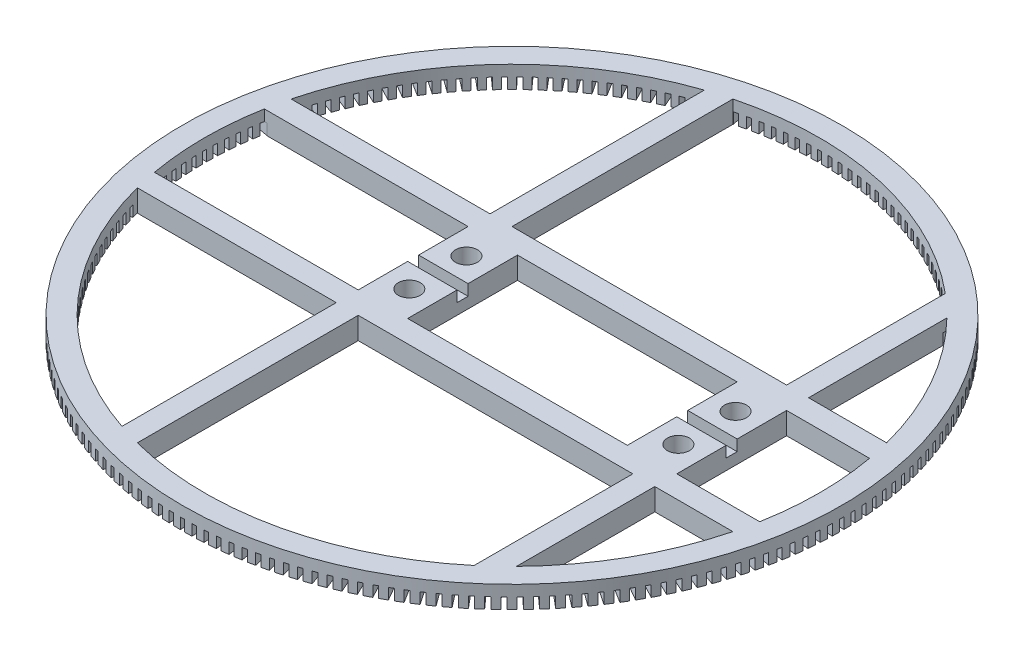
from build123d import *

# Parameters (mm, degrees)
SKETCH1_R           = 60
SKETCH1_R_2         = 2
SKETCH1_W           = 40
SKETCH1_H           = 20
BOSS_EXTRUDE1_DEPTH = 4
SKETCH3_W           = 58
SKETCH3_H           = 2
CUT_EXTRUDE1_DEPTH  = 2
SKETCH4_W           = 5
SKETCH4_H           = 0.8
SKETCH4_W_2         = 0.8
SKETCH4_H_2         = 5
CUT_EXTRUDE10_DEPTH = 2
SKETCH6_W           = 5
SKETCH6_H           = 0.8
SKETCH6_W_2         = 0.8
SKETCH6_H_2         = 5
CUT_EXTRUDE11_DEPTH = 2


with BuildPart() as part:
    # Sketch1 → Boss-Extrude1 (new body)
    with BuildSketch(Plane(origin=(0, 0, 0), x_dir=(1, 0, 0), z_dir=(0, 1, 0))):
        with Locations((-11, 0)):
            Circle(SKETCH1_R)
        with BuildLine():
            Line((-29, 10), (-29, -10))
            Line((-29, -10), (-66.099909256, -10))
            ThreePointArc((-66.099909256, -10), (-67, 0), (-66.099909256, 10))
            Line((-66.099909256, 10), (-29, 10))
        make_face(mode=Mode.SUBTRACT)
        with BuildLine():
            Line((25, 14), (-25, 14))
            Line((-25, 14), (-25, 54.221766847))
            ThreePointArc((-25, 54.221766847), (1.372253602, 54.616182042), (25, 42.895221179))
            Line((25, 42.895221179), (25, 14))
        make_face(mode=Mode.SUBTRACT)
        with BuildLine():
            Line((29, -10), (29, 10))
            Line((29, 10), (44.099909256, 10))
            ThreePointArc((44.099909256, 10), (45, 0), (44.099909256, -10))
            Line((44.099909256, -10), (29, -10))
        make_face(mode=Mode.SUBTRACT)
        with BuildLine():
            Line((-25, -14), (25, -14))
            Line((25, -14), (25, -42.895221179))
            ThreePointArc((25, -42.895221179), (1.372253602, -54.616182042), (-25, -54.221766847))
            Line((-25, -54.221766847), (-25, -14))
        make_face(mode=Mode.SUBTRACT)
        with Locations((-24.5, -5.2)):
            Circle(SKETCH1_R_2, mode=Mode.SUBTRACT)
        with Locations((24.5, -5.2)):
            Circle(SKETCH1_R_2, mode=Mode.SUBTRACT)
        with Locations((-24.5, 5.2)):
            Circle(SKETCH1_R_2, mode=Mode.SUBTRACT)
        Rectangle(SKETCH1_W, SKETCH1_H, mode=Mode.SUBTRACT)
        with Locations((24.5, 5.2)):
            Circle(SKETCH1_R_2, mode=Mode.SUBTRACT)
        with BuildLine():
            Line((-65.221766847, -14), (-29, -14))
            Line((-29, -14), (-29, -53.028294334))
            ThreePointArc((-29, -53.028294334), (-52.046289007, -38.094647376), (-65.221766847, -14))
        make_face(mode=Mode.SUBTRACT)
        with BuildLine():
            Line((-29, 14), (-65.221766847, 14))
            ThreePointArc((-65.221766847, 14), (-52.046289007, 38.094647376), (-29, 53.028294334))
            Line((-29, 53.028294334), (-29, 14))
        make_face(mode=Mode.SUBTRACT)
        with BuildLine():
            Line((29, 14), (29, 39.191835885))
            ThreePointArc((29, 39.191835885), (37.765689637, 27.530120128), (43.221766847, 14))
            Line((43.221766847, 14), (29, 14))
        make_face(mode=Mode.SUBTRACT)
        with BuildLine():
            Line((29, -14), (43.221766847, -14))
            ThreePointArc((43.221766847, -14), (37.765689637, -27.530120128), (29, -39.191835885))
            Line((29, -39.191835885), (29, -14))
        make_face(mode=Mode.SUBTRACT)
    extrude(amount=BOSS_EXTRUDE1_DEPTH)

    # Sketch3 → Cut-Extrude1 (cut)
    with BuildSketch(Plane(origin=(0, 4, 0), x_dir=(1, 0, 0), z_dir=(0, 1, 0))):
        Rectangle(SKETCH3_W, SKETCH3_H)
    extrude(amount=-CUT_EXTRUDE1_DEPTH, mode=Mode.SUBTRACT)

    # Sketch4 → Cut-Extrude10 (cut)
    with BuildSketch(Plane.XZ):
        Polygon((-71.449185236, 2.511175881), (-71.477104833, 1.71166322), (-66.480150698, 1.537165736), (-66.452231101, 2.336678398), align=None)
        with Locations((-69, 0)):
            Rectangle(SKETCH4_W, SKETCH4_H)
        Polygon((-71.324722451, 4.619292282), (-71.38052763, 3.821241041), (-66.392707379, 3.472458673), (-66.3369022, 4.270509913), align=None)
        Polygon((-71.126763284, 6.721780786), (-71.210386055, 5.92616327), (-66.237776578, 5.403520953), (-66.154153808, 6.19913847), align=None)
        Polygon((-70.855548918, 8.816079836), (-70.966887399, 8.023865381), (-66.015547056, 7.327999876), (-65.904208575, 8.120214331), align=None)
        Polygon((-70.511409786, 10.89963785), (-70.650328328, 10.111791648), (-65.726289563, 9.243550759), (-65.587371021, 10.031396962), align=None)
        Polygon((-70.094765168, 12.969916335), (-70.261094521, 12.187398254), (-65.370356517, 11.1478398), (-65.204027164, 11.930357881), align=None)
        Polygon((-69.606122681, 15.024392974), (-69.799660198, 14.248156393), (-64.948181567, 13.038546915), (-64.75464405, 13.814783496), align=None)
        Polygon((-69.046077662, 17.060564705), (-69.266587547, 16.291555349), (-64.460279067, 14.913368569), (-64.239769182, 15.682377926), align=None)
        Polygon((-68.415312438, 19.075950766), (-68.662526034, 18.315105553), (-63.907243452, 16.770020581), (-63.660029857, 17.530865794), align=None)
        Polygon((-67.7145955, 21.06809572), (-67.988211615, 20.316341623), (-63.289748511, 18.606240906), (-63.016132396, 19.357995003), align=None)
        Polygon((-66.944780564, 23.034572443), (-67.244465839, 22.29282536), (-62.608546566, 20.419792393), (-62.308861291, 21.161539476), align=None)
        Polygon((-66.10680553, 24.972985089), (-66.432194845, 24.242148723), (-61.864467556, 22.208465508), (-61.539078242, 22.939301874), align=None)
        Polygon((-65.201691342, 26.880971999), (-65.55238826, 26.161936762), (-61.058418028, 23.970081028), (-60.707721111, 24.689116265), align=None)
        Polygon((-64.230540743, 28.756208586), (-64.606117993, 28.049850511), (-60.191380029, 25.702492697), (-59.815802779, 26.408850772), align=None)
        Polygon((-63.194536929, 30.596410162), (-63.594536929, 29.903589838), (-59.26440991, 27.403589838), (-58.86440991, 28.096410162), align=None)
        Polygon((-62.094942112, 32.399334725), (-62.518877523, 31.720896248), (-58.278637042, 29.071299926), (-57.854701631, 29.749738403), align=None)
        Polygon((-60.933095978, 34.162785689), (-61.380450301, 33.499555631), (-57.235262438, 30.703591114), (-56.787908115, 31.366821172), align=None)
        Polygon((-59.710414059, 35.884614561), (-60.180642261, 35.237400966), (-56.135557289, 32.298474704), (-55.665329087, 32.9456883), align=None)
        Polygon((-58.428386003, 37.562723559), (-58.920915183, 36.932314956), (-54.980861415, 33.854007579), (-54.488332235, 34.484416182), align=None)
        Polygon((-57.088573765, 39.195068163), (-57.602803853, 38.582232609), (-53.772581637, 35.36829456), (-53.258351549, 35.981130115), align=None)
        Polygon((-55.692609699, 40.779659615), (-56.227914184, 40.185143755), (-52.512190057, 36.839490723), (-51.976885571, 37.434006583), align=None)
        Polygon((-54.242194572, 42.314567333), (-54.797921269, 41.739095493), (-51.201222267, 38.26580364), (-50.645495571, 38.841275481), align=None)
        Polygon((-52.739095493, 43.797921269), (-53.314567333, 43.242194572), (-49.841275481, 39.645495571), (-49.26580364, 40.201222267), align=None)
        Polygon((-51.185143755, 45.227914184), (-51.779659615, 44.692609699), (-48.434006583, 40.976885571), (-47.839490723, 41.512190057), align=None)
        Polygon((-49.582232609, 46.602803853), (-50.195068163, 46.088573765), (-46.981130115, 42.258351549), (-46.36829456, 42.772581637), align=None)
        Polygon((-47.932314956, 47.920915183), (-48.562723559, 47.428386003), (-45.484416182, 43.488332235), (-44.854007579, 43.980861415), align=None)
        Polygon((-46.237400966, 49.180642261), (-46.884614561, 48.710414059), (-43.9456883, 44.665329087), (-43.298474704, 45.135557289), align=None)
        Polygon((-44.499555631, 50.380450301), (-45.162785689, 49.933095978), (-42.366821172, 45.787908115), (-41.703591114, 46.235262438), align=None)
        Polygon((-42.720896248, 51.518877523), (-43.399334725, 51.094942112), (-40.749738403, 46.854701631), (-40.071299926, 47.278637042), align=None)
        Polygon((-40.903589838, 52.594536929), (-41.596410162, 52.194536929), (-39.096410162, 47.86440991), (-38.403589838, 48.26440991), align=None)
        Polygon((-39.049850511, 53.606117993), (-39.756208586, 53.230540743), (-37.408850772, 48.815802779), (-36.702492697, 49.191380029), align=None)
        Polygon((-37.161936762, 54.55238826), (-37.880971999, 54.201691342), (-35.689116265, 49.707721111), (-34.970081028, 50.058418028), align=None)
        Polygon((-35.242148723, 55.432194845), (-35.972985089, 55.10680553), (-33.939301874, 50.539078242), (-33.208465508, 50.864467556), align=None)
        Polygon((-33.29282536, 56.244465839), (-34.034572443, 55.944780564), (-32.161539476, 51.308861291), (-31.419792393, 51.608546566), align=None)
        Polygon((-31.316341623, 56.988211615), (-32.06809572, 56.7145955), (-30.357995003, 52.016132396), (-29.606240906, 52.289748511), align=None)
        Polygon((-29.315105553, 57.662526034), (-30.075950766, 57.415312438), (-28.530865794, 52.660029857), (-27.770020581, 52.907243452), align=None)
        Polygon((-27.291555349, 58.266587547), (-28.060564705, 58.046077662), (-26.682377926, 53.239769182), (-25.913368569, 53.460279067), align=None)
        Polygon((-25.248156393, 58.799660198), (-26.024392974, 58.606122681), (-24.814783496, 53.75464405), (-24.038546915, 53.948181567), align=None)
        Polygon((-23.187398254, 59.261094521), (-23.969916335, 59.094765168), (-22.930357881, 54.204027164), (-22.1478398, 54.370356517), align=None)
        Polygon((-21.111791648, 59.650328328), (-21.89963785, 59.511409786), (-21.031396962, 54.587371021), (-20.243550759, 54.726289563), align=None)
        Polygon((-19.023865381, 59.966887399), (-19.816079836, 59.855548918), (-19.120214331, 54.904208575), (-18.327999876, 55.015547056), align=None)
        Polygon((-16.92616327, 60.210386055), (-17.721780786, 60.126763284), (-17.19913847, 55.154153808), (-16.403520953, 55.237776578), align=None)
        Polygon((-14.821241041, 60.38052763), (-15.619292282, 60.324722451), (-15.270509913, 55.3369022), (-14.472458673, 55.392707379), align=None)
        Polygon((-12.71166322, 60.477104833), (-13.511175881, 60.449185236), (-13.336678398, 55.452231101), (-12.537165736, 55.480150698), align=None)
        with Locations((-11, 58)):
            Rectangle(SKETCH4_W_2, SKETCH4_H_2)
        Polygon((-8.488824119, 60.449185236), (-9.28833678, 60.477104833), (-9.462834264, 55.480150698), (-8.663321602, 55.452231101), align=None)
        Polygon((-6.380707718, 60.324722451), (-7.178758959, 60.38052763), (-7.527541327, 55.392707379), (-6.729490087, 55.3369022), align=None)
        Polygon((-4.278219214, 60.126763284), (-5.07383673, 60.210386055), (-5.596479047, 55.237776578), (-4.800861531, 55.154153808), align=None)
        Polygon((-2.183920164, 59.855548918), (-2.976134619, 59.966887399), (-3.672000124, 55.015547056), (-2.879785669, 54.904208575), align=None)
        Polygon((-0.10036215, 59.511409786), (-0.888208352, 59.650328328), (-1.756449241, 54.726289563), (-0.968603038, 54.587371021), align=None)
        Polygon((1.969916335, 59.094765168), (1.187398254, 59.261094521), (0.1478398, 54.370356517), (0.930357881, 54.204027164), align=None)
        Polygon((4.024392974, 58.606122681), (3.248156393, 58.799660198), (2.038546915, 53.948181567), (2.814783496, 53.75464405), align=None)
        Polygon((6.060564705, 58.046077662), (5.291555349, 58.266587547), (3.913368569, 53.460279067), (4.682377926, 53.239769182), align=None)
        Polygon((8.075950766, 57.415312438), (7.315105553, 57.662526034), (5.770020581, 52.907243452), (6.530865794, 52.660029857), align=None)
        Polygon((10.06809572, 56.7145955), (9.316341623, 56.988211615), (7.606240906, 52.289748511), (8.357995003, 52.016132396), align=None)
        Polygon((12.034572443, 55.944780564), (11.29282536, 56.244465839), (9.419792393, 51.608546566), (10.161539476, 51.308861291), align=None)
        Polygon((13.972985089, 55.10680553), (13.242148723, 55.432194845), (11.208465508, 50.864467556), (11.939301874, 50.539078242), align=None)
        Polygon((15.880971999, 54.201691342), (15.161936762, 54.55238826), (12.970081028, 50.058418028), (13.689116265, 49.707721111), align=None)
        Polygon((17.756208586, 53.230540743), (17.049850511, 53.606117993), (14.702492697, 49.191380029), (15.408850772, 48.815802779), align=None)
        Polygon((19.596410162, 52.194536929), (18.903589838, 52.594536929), (16.403589838, 48.26440991), (17.096410162, 47.86440991), align=None)
        Polygon((21.399334725, 51.094942112), (20.720896248, 51.518877523), (18.071299926, 47.278637042), (18.749738403, 46.854701631), align=None)
        Polygon((23.162785689, 49.933095978), (22.499555631, 50.380450301), (19.703591114, 46.235262438), (20.366821172, 45.787908115), align=None)
        Polygon((24.884614561, 48.710414059), (24.237400966, 49.180642261), (21.298474704, 45.135557289), (21.9456883, 44.665329087), align=None)
        Polygon((26.562723559, 47.428386003), (25.932314956, 47.920915183), (22.854007579, 43.980861415), (23.484416182, 43.488332235), align=None)
        Polygon((34.227914184, 40.185143755), (33.692609699, 40.779659615), (29.976885571, 37.434006583), (30.512190057, 36.839490723), align=None)
        Polygon((35.602803853, 38.582232609), (35.088573765, 39.195068163), (31.258351549, 35.981130115), (31.772581637, 35.36829456), align=None)
        Polygon((36.920915183, 36.932314956), (36.428386003, 37.562723559), (32.488332235, 34.484416182), (32.980861415, 33.854007579), align=None)
        Polygon((38.180642261, 35.237400966), (37.710414059, 35.884614561), (33.665329087, 32.9456883), (34.135557289, 32.298474704), align=None)
        Polygon((39.380450301, 33.499555631), (38.933095978, 34.162785689), (34.787908115, 31.366821172), (35.235262438, 30.703591114), align=None)
        Polygon((40.518877523, 31.720896248), (40.094942112, 32.399334725), (35.854701631, 29.749738403), (36.278637042, 29.071299926), align=None)
        Polygon((41.594536929, 29.903589838), (41.194536929, 30.596410162), (36.86440991, 28.096410162), (37.26440991, 27.403589838), align=None)
        Polygon((42.606117993, 28.049850511), (42.230540743, 28.756208586), (37.815802779, 26.408850772), (38.191380029, 25.702492697), align=None)
        Polygon((43.55238826, 26.161936762), (43.201691342, 26.880971999), (38.707721111, 24.689116265), (39.058418028, 23.970081028), align=None)
        Polygon((44.432194845, 24.242148723), (44.10680553, 24.972985089), (39.539078242, 22.939301874), (39.864467556, 22.208465508), align=None)
        Polygon((-70.650328328, -10.111791648), (-70.511409786, -10.89963785), (-65.587371021, -10.031396962), (-65.726289563, -9.243550759), align=None)
        Polygon((-70.966887399, -8.023865381), (-70.855548918, -8.816079836), (-65.904208575, -8.120214331), (-66.015547056, -7.327999876), align=None)
        Polygon((-71.210386055, -5.92616327), (-71.126763284, -6.721780786), (-66.154153808, -6.19913847), (-66.237776578, -5.403520953), align=None)
        Polygon((-71.38052763, -3.821241041), (-71.324722451, -4.619292282), (-66.3369022, -4.270509913), (-66.392707379, -3.472458673), align=None)
        Polygon((-71.477104833, -1.71166322), (-71.449185236, -2.511175881), (-66.452231101, -2.336678398), (-66.480150698, -1.537165736), align=None)
    extrude(amount=-CUT_EXTRUDE10_DEPTH, mode=Mode.SUBTRACT)

    # Sketch6 → Cut-Extrude11 (cut)
    with BuildSketch(Plane.XZ.offset(-2)):
        Polygon((28.191222958, 46.057855382), (27.578387404, 46.57208547), (24.364449355, 42.741863254), (24.97728491, 42.227633167), align=None)
        Polygon((29.77581441, 44.661891316), (29.18129855, 45.197195801), (25.835645518, 41.481471674), (26.430161378, 40.946167189), align=None)
        Polygon((31.310722128, 43.21147619), (30.735250288, 43.767202886), (27.261958435, 40.170503884), (27.837430276, 39.614777188), align=None)
        Polygon((32.794076064, 41.70837711), (32.238349367, 42.28384895), (28.641650366, 38.810557098), (29.197377062, 38.235085258), align=None)
        Polygon((34.224068979, 40.154425372), (33.688764494, 40.748941232), (29.973040367, 37.4032882), (30.508344852, 36.80877234), align=None)
        Polygon((45.240620634, 22.262106977), (44.940935359, 23.003854061), (40.305016086, 21.130821094), (40.604701361, 20.38907401), align=None)
        Polygon((45.98436641, 20.28562324), (45.710750295, 21.037377337), (41.012287191, 19.32727662), (41.285903306, 18.575522524), align=None)
        Polygon((46.658680829, 18.284387171), (46.411467233, 19.045232384), (41.656184652, 17.500147412), (41.903398247, 16.739302199), align=None)
        Polygon((47.262742342, 16.260836966), (47.042232457, 17.029846323), (42.235923977, 15.651659544), (42.456433862, 14.882650187), align=None)
        Polygon((47.795814993, 14.217438011), (47.602277477, 14.993674592), (42.750798845, 13.784065114), (42.944336362, 13.007828533), align=None)
        Polygon((48.257249316, 12.156679872), (48.090919963, 12.939197952), (43.200181959, 11.899639498), (43.366511312, 11.117121417), align=None)
        Polygon((48.646483123, 10.081073265), (48.507564581, 10.868919467), (43.583525816, 10.000678579), (43.722444358, 9.212832377), align=None)
        Polygon((48.963042194, 7.993146998), (48.851703714, 8.785361453), (43.90036337, 8.089495948), (44.011701851, 7.297281493), align=None)
        Polygon((49.20654085, 5.895444887), (49.12291808, 6.691062403), (44.150308603, 6.168420087), (44.233931373, 5.372802571), align=None)
        Polygon((49.376682425, 3.790522659), (49.320877246, 4.588573899), (44.333056995, 4.23979153), (44.388862174, 3.44174029), align=None)
        Polygon((49.473259628, 1.680944837), (49.445340031, 2.480457499), (44.448385896, 2.305960015), (44.476305493, 1.506447354), align=None)
        with Locations((46.996154795, -0.030718383)):
            Rectangle(SKETCH6_W, SKETCH6_H)
        Polygon((49.445340031, -2.541894264), (49.473259628, -1.742381602), (44.476305493, -1.567884119), (44.448385896, -2.36739678), align=None)
        Polygon((49.320877246, -4.650010664), (49.376682425, -3.851959424), (44.388862174, -3.503177055), (44.333056995, -4.301228296), align=None)
        Polygon((49.12291808, -6.752499168), (49.20654085, -5.956881652), (44.233931373, -5.434239336), (44.150308603, -6.229856852), align=None)
        Polygon((48.851703714, -8.846798218), (48.963042194, -8.054583763), (44.011701851, -7.358718258), (43.90036337, -8.150932713), align=None)
        Polygon((48.507564581, -10.930356233), (48.646483123, -10.14251003), (43.722444358, -9.274269142), (43.583525816, -10.062115344), align=None)
        Polygon((48.090919963, -13.000634717), (48.257249316, -12.218116637), (43.366511312, -11.178558183), (43.200181959, -11.961076263), align=None)
        Polygon((47.602277477, -15.055111357), (47.795814993, -14.278874776), (42.944336362, -13.069265298), (42.750798845, -13.845501879), align=None)
        Polygon((47.042232457, -17.091283088), (47.262742342, -16.322273731), (42.456433862, -14.944086952), (42.235923977, -15.713096309), align=None)
        Polygon((46.411467233, -19.106669149), (46.658680829, -18.345823936), (41.903398247, -16.800738964), (41.656184652, -17.561584177), align=None)
        Polygon((45.710750295, -21.098814102), (45.98436641, -20.347060006), (41.285903306, -18.636959289), (41.012287191, -19.388713386), align=None)
        Polygon((44.940935359, -23.065290826), (45.240620634, -22.323543742), (40.604701361, -20.450510775), (40.305016086, -21.192257859), align=None)
        Polygon((44.102960325, -25.003703472), (44.42834964, -24.272867106), (39.860622351, -22.23918389), (39.535233037, -22.970020256), align=None)
        Polygon((43.197846137, -26.911690382), (43.548543055, -26.192655145), (39.054572823, -24.000799411), (38.703875906, -24.719834648), align=None)
        Polygon((42.226695538, -28.786926968), (42.602272788, -28.080568894), (38.187534824, -25.73321108), (37.811957574, -26.439569154), align=None)
        Polygon((41.190691724, -30.627128544), (41.590691724, -29.934308221), (37.260564705, -27.434308221), (36.860564705, -28.127128544), align=None)
        Polygon((40.091096907, -32.430053107), (40.515032318, -31.75161463), (36.274791837, -29.102018309), (35.850856426, -29.780456786), align=None)
        Polygon((38.929250773, -34.193504072), (39.376605096, -33.530274014), (35.231417233, -30.734309496), (34.78406291, -31.397539554), align=None)
        Polygon((37.706568854, -35.915332944), (38.176797056, -35.268119349), (34.131712084, -32.329193087), (33.661483882, -32.976406683), align=None)
        Polygon((36.424540798, -37.593441941), (36.917069978, -36.963033338), (32.97701621, -33.884725962), (32.48448703, -34.515134565), align=None)
        Polygon((35.08472856, -39.225786546), (35.598958648, -38.612950991), (31.768736432, -35.399012943), (31.254506344, -36.011848497), align=None)
        Polygon((33.688764494, -40.810377998), (34.224068979, -40.215862137), (30.508344852, -36.870209105), (29.973040367, -37.464724966), align=None)
        Polygon((32.238349367, -42.345285716), (32.794076064, -41.769813875), (29.197377062, -38.296522023), (28.641650366, -38.871993863), align=None)
        Polygon((30.735250288, -43.828639651), (31.310722128, -43.272912955), (27.837430276, -39.676213953), (27.261958435, -40.23194065), align=None)
        Polygon((29.18129855, -45.258632567), (29.77581441, -44.723328081), (26.430161378, -41.007603954), (25.835645518, -41.542908439), align=None)
        Polygon((27.578387404, -46.633522235), (28.191222958, -46.119292147), (24.97728491, -42.289069932), (24.364449355, -42.80330002), align=None)
        Polygon((25.928469751, -47.951633566), (26.558878354, -47.459104386), (23.480570977, -43.519050618), (22.850162374, -44.011579798), align=None)
        Polygon((24.233555761, -49.211360643), (24.880769357, -48.741132441), (21.941843095, -44.69604747), (21.2946295, -45.166275671), align=None)
        Polygon((22.495710426, -50.411168684), (23.158940484, -49.963814361), (20.362975967, -45.818626498), (19.699745909, -46.265980821), align=None)
        Polygon((20.717051043, -51.549595906), (21.39548952, -51.125660494), (18.745893198, -46.885420014), (18.067454722, -47.309355425), align=None)
        Polygon((18.899744634, -52.625255312), (19.592564957, -52.225255312), (17.092564957, -47.895128293), (16.399744634, -48.295128293), align=None)
        Polygon((17.046005306, -53.636836376), (17.752363381, -53.261259125), (15.405005567, -48.846521161), (14.698647493, -49.222098411), align=None)
        Polygon((15.158091557, -54.583106642), (15.877126794, -54.232409725), (13.68527106, -49.738439494), (12.966235823, -50.089136411), align=None)
        Polygon((13.238303518, -55.462913227), (13.969139884, -55.137523913), (11.935456669, -50.569796625), (11.204620303, -50.895185939), align=None)
        Polygon((11.288980155, -56.275184221), (12.030727239, -55.975498947), (10.157694271, -51.339579674), (9.415947188, -51.639264948), align=None)
        Polygon((9.312496418, -57.018929998), (10.064250515, -56.745313883), (8.354149798, -52.046850779), (7.602395701, -52.320466894), align=None)
        Polygon((7.311260348, -57.693244416), (8.072105561, -57.446030821), (6.527020589, -52.690748239), (5.766175376, -52.937961835), align=None)
        Polygon((5.287710144, -58.297305929), (6.0567195, -58.076796045), (4.678532721, -53.270487565), (3.909523365, -53.49099745), align=None)
        Polygon((3.244311188, -58.830378581), (4.020547769, -58.636841064), (2.810938291, -53.785362433), (2.03470171, -53.978899949), align=None)
        Polygon((1.183553049, -59.291812903), (1.96607113, -59.125483551), (0.926512676, -54.234745547), (0.143994595, -54.4010749), align=None)
        Polygon((-0.892053557, -59.681046711), (-0.104207355, -59.542128169), (-0.972448243, -54.618089404), (-1.760294446, -54.757007946), align=None)
        Polygon((-2.979979824, -59.997605782), (-2.187765369, -59.886267301), (-2.883630874, -54.934926957), (-3.675845329, -55.046265438), align=None)
        Polygon((-5.077681935, -60.241104438), (-4.282064419, -60.157481667), (-4.804706735, -55.18487219), (-5.600324252, -55.268494961), align=None)
        Polygon((-7.182604164, -60.411246013), (-6.384552923, -60.355440834), (-6.733335292, -55.367620583), (-7.531386532, -55.423425762), align=None)
        Polygon((-9.292181985, -60.507823216), (-8.492669324, -60.479903619), (-8.667166807, -55.482949484), (-9.466679469, -55.510869081), align=None)
        with Locations((-11.003845205, -58.030718383)):
            Rectangle(SKETCH6_W_2, SKETCH6_H_2)
        Polygon((-13.515021086, -60.479903619), (-12.715508425, -60.507823216), (-12.541010941, -55.510869081), (-13.340523603, -55.482949484), align=None)
        Polygon((-15.623137487, -60.355440834), (-14.825086246, -60.411246013), (-14.476303878, -55.423425762), (-15.274355118, -55.367620583), align=None)
        Polygon((-17.725625991, -60.157481667), (-16.930008474, -60.241104438), (-16.407366158, -55.268494961), (-17.202983674, -55.18487219), align=None)
        Polygon((-19.819925041, -59.886267301), (-19.027710586, -59.997605782), (-18.331845081, -55.046265438), (-19.124059536, -54.934926957), align=None)
        Polygon((-21.903483055, -59.542128169), (-21.115636853, -59.681046711), (-20.247395964, -54.757007946), (-21.035242167, -54.618089404), align=None)
        Polygon((-23.97376154, -59.125483551), (-23.191243459, -59.291812903), (-22.151685005, -54.4010749), (-22.934203086, -54.234745547), align=None)
        Polygon((-26.028238179, -58.636841064), (-25.252001598, -58.830378581), (-24.04239212, -53.978899949), (-24.818628701, -53.785362433), align=None)
        Polygon((-28.06440991, -58.076796045), (-27.295400553, -58.297305929), (-25.917213774, -53.49099745), (-26.686223131, -53.270487565), align=None)
        Polygon((-30.079795971, -57.446030821), (-29.318950758, -57.693244416), (-27.773865786, -52.937961835), (-28.534710999, -52.690748239), align=None)
        Polygon((-32.071940924, -56.745313883), (-31.320186828, -57.018929998), (-29.610086111, -52.320466894), (-30.361840208, -52.046850779), align=None)
        Polygon((-34.038417648, -55.975498947), (-33.296670565, -56.275184221), (-31.423637598, -51.639264948), (-32.165384681, -51.339579674), align=None)
        Polygon((-35.976830294, -55.137523913), (-35.245993928, -55.462913227), (-33.212310713, -50.895185939), (-33.943147079, -50.569796625), align=None)
        Polygon((-37.884817204, -54.232409725), (-37.165781967, -54.583106642), (-34.973926233, -50.089136411), (-35.69296147, -49.738439494), align=None)
        Polygon((-39.760053791, -53.261259125), (-39.053695716, -53.636836376), (-36.706337902, -49.222098411), (-37.412695977, -48.846521161), align=None)
        Polygon((-41.600255366, -52.225255312), (-40.907435043, -52.625255312), (-38.407435043, -48.295128293), (-39.100255366, -47.895128293), align=None)
        Polygon((-43.403179929, -51.125660494), (-42.724741453, -51.549595906), (-40.075145131, -47.309355425), (-40.753583608, -46.885420014), align=None)
        Polygon((-45.166630894, -49.963814361), (-44.503400836, -50.411168684), (-41.707436319, -46.265980821), (-42.370666377, -45.818626498), align=None)
        Polygon((-46.888459766, -48.741132441), (-46.241246171, -49.211360643), (-43.302319909, -45.166275671), (-43.949533505, -44.69604747), align=None)
        Polygon((-48.566568764, -47.459104386), (-47.936160161, -47.951633566), (-44.857852784, -44.011579798), (-45.488261387, -43.519050618), align=None)
        Polygon((-50.198913368, -46.119292147), (-49.586077814, -46.633522235), (-46.372139765, -42.80330002), (-46.98497532, -42.289069932), align=None)
        Polygon((-51.78350482, -44.723328081), (-51.188988959, -45.258632567), (-47.843335928, -41.542908439), (-48.437851788, -41.007603954), align=None)
        Polygon((-53.318412538, -43.272912955), (-52.742940698, -43.828639651), (-49.269648845, -40.23194065), (-49.845120686, -39.676213953), align=None)
        Polygon((-54.801766474, -41.769813875), (-54.246039777, -42.345285716), (-50.649340776, -38.871993863), (-51.205067472, -38.296522023), align=None)
        Polygon((-56.231759389, -40.215862137), (-55.696454904, -40.810377998), (-51.980730776, -37.464724966), (-52.516035261, -36.870209105), align=None)
        Polygon((-57.606649058, -38.612950991), (-57.09241897, -39.225786546), (-53.262196754, -36.011848497), (-53.776426842, -35.399012943), align=None)
        Polygon((-58.924760388, -36.963033338), (-58.432231208, -37.593441941), (-54.49217744, -34.515134565), (-54.98470662, -33.884725962), align=None)
        Polygon((-60.184487466, -35.268119349), (-59.714259264, -35.915332944), (-55.669174292, -32.976406683), (-56.139402494, -32.329193087), align=None)
        Polygon((-61.384295506, -33.530274014), (-60.936941183, -34.193504072), (-56.79175332, -31.397539554), (-57.239107643, -30.734309496), align=None)
        Polygon((-62.522722728, -31.75161463), (-62.098787317, -32.430053107), (-57.858546836, -29.780456786), (-58.282482247, -29.102018309), align=None)
        Polygon((-63.598382134, -29.934308221), (-63.198382134, -30.627128544), (-58.868255115, -28.127128544), (-59.268255115, -27.434308221), align=None)
        Polygon((-64.609963198, -28.080568894), (-64.234385948, -28.786926968), (-59.819647983, -26.439569154), (-60.195225234, -25.73321108), align=None)
        Polygon((-65.556233465, -26.192655145), (-65.205536547, -26.911690382), (-60.711566316, -24.719834648), (-61.062263233, -24.000799411), align=None)
        Polygon((-66.43604005, -24.272867106), (-66.110650735, -25.003703472), (-61.542923447, -22.970020256), (-61.868312761, -22.23918389), align=None)
        Polygon((-67.248311044, -22.323543742), (-66.948625769, -23.065290826), (-62.312706496, -21.192257859), (-62.612391771, -20.450510775), align=None)
        Polygon((-67.99205682, -20.347060006), (-67.718440705, -21.098814102), (-63.019977601, -19.388713386), (-63.293593716, -18.636959289), align=None)
        Polygon((-68.666371239, -18.345823936), (-68.419157643, -19.106669149), (-63.663875062, -17.561584177), (-63.911088657, -16.800738964), align=None)
        Polygon((-69.270432752, -16.322273731), (-69.049922867, -17.091283088), (-64.243614387, -15.713096309), (-64.464124272, -14.944086952), align=None)
        Polygon((-69.803505403, -14.278874776), (-69.609967886, -15.055111357), (-64.758489255, -13.845501879), (-64.952026771, -13.069265298), align=None)
        Polygon((-70.264939726, -12.218116637), (-70.098610373, -13.000634717), (-65.207872369, -11.961076263), (-65.374201722, -11.178558183), align=None)
    extrude(amount=CUT_EXTRUDE11_DEPTH, mode=Mode.SUBTRACT)


solid = part.part
